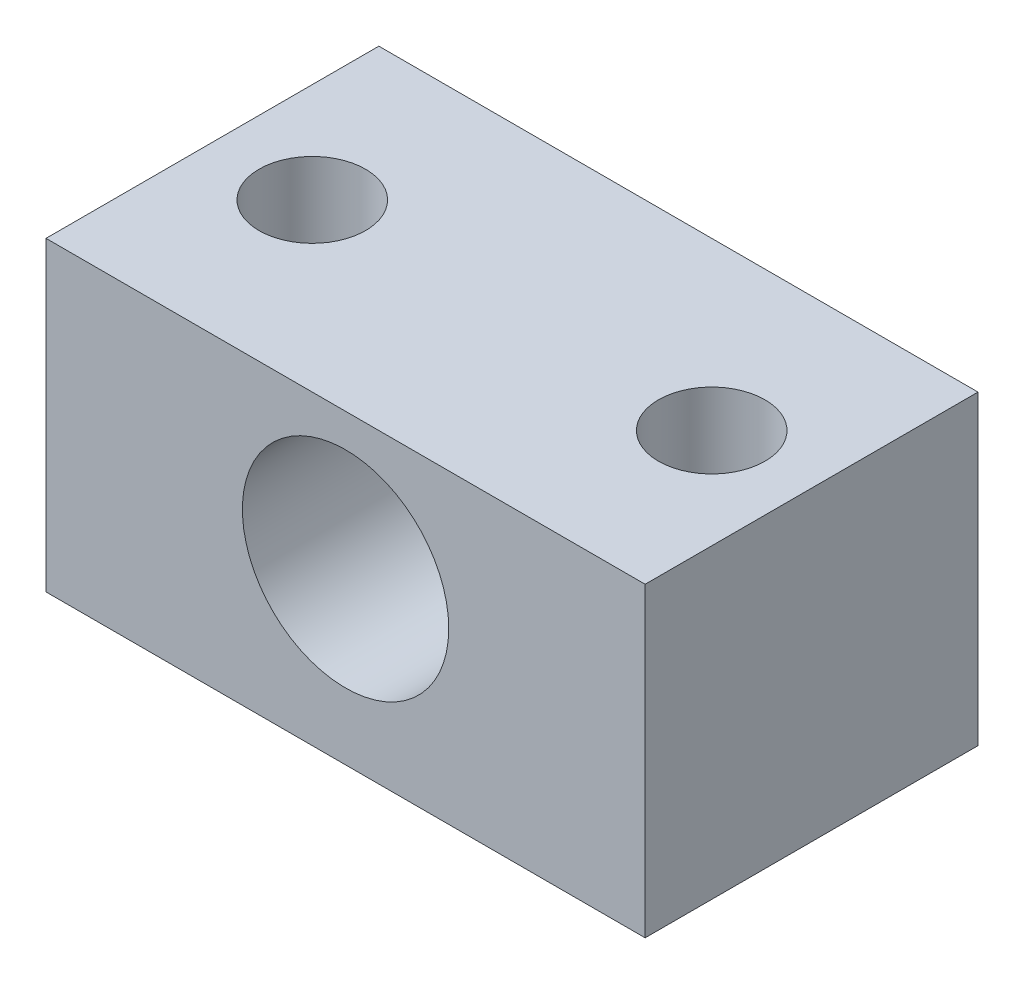
from build123d import *

# Parameters (mm, degrees)
SKETCH_1_W          = 18
SKETCH_1_H          = 9.2
SKETCH_1_R          = 3.1
EXTRUDE_1_DEPTH     = 10
SKETCH_2_R          = 1.6
CUT_EXTRUDE_1_DEPTH = 10


with BuildPart() as part:
    # ｽｹｯﾁ1 → ﾎﾞｽ - 押し出し1 (new body)
    with BuildSketch(Plane.XY):
        with Locations((0, -0.5)):
            Rectangle(SKETCH_1_W, SKETCH_1_H)
        Circle(SKETCH_1_R, mode=Mode.SUBTRACT)
    extrude(amount=EXTRUDE_1_DEPTH)

    # ｽｹｯﾁ2 → ｶｯﾄ - 押し出し1 (cut)
    with BuildSketch(Plane(origin=(0, 4.1, 0), x_dir=(1, 0, 0), z_dir=(0, 1, 0))):
        with Locations((-6, -5)):
            Circle(SKETCH_2_R)
        with Locations((6, -5)):
            Circle(SKETCH_2_R)
    extrude(amount=-CUT_EXTRUDE_1_DEPTH, mode=Mode.SUBTRACT)


solid = part.part
